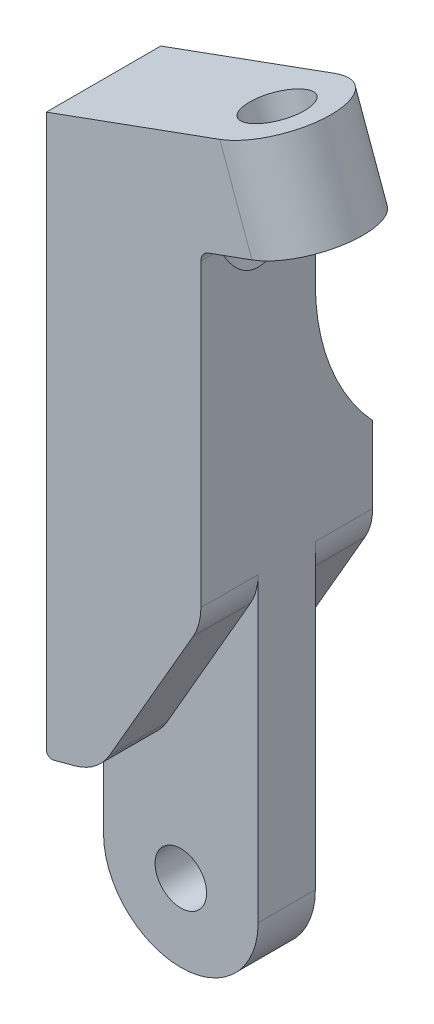
from build123d import *

# Parameters (mm, degrees)
BOSS_EXTRUDE1_DEPTH    = 7.5
CUT_EXTRUDE1_DEPTH     = 5
M4_CLEARANCE_HOLE1_D   = 4.5
BOSS_EXTRUDE2_DEPTH    = 15
CUT_EXTRUDE5_START     = -15
CUT_EXTRUDE5_DEPTH     = 5
FILLET8_R              = 1
FILLET4_R              = 19
FILLET1_R              = 0.5
FILLET7_R              = 5
FILLET6_RADIUS         = 5
FILLET6_LENGTH         = 8.210867904
F_10_CLEARANCE_HOLE1_D = 5.1054
FILLET9_R              = 5
FILLET10_R             = 1
SKETCH15_R             = 6
CUT_EXTRUDE7_DEPTH     = 16


with BuildPart() as part:
    # Sketch1 → Boss-Extrude1 (new, symmetric)
    with BuildSketch(Plane.XY):
        with BuildLine():
            Line((-6.749999988, 53.250000012), (6.749999988, 53.250000012))
            Line((6.749999988, 53.250000012), (6.749999988, 0))
            ThreePointArc((6.749999988, 0), (0, -6.749999988), (-6.749999988, 0))
            Line((-6.749999988, 0), (-6.749999988, 53.250000012))
        make_face()
    extrude(amount=BOSS_EXTRUDE1_DEPTH, both=True)

    # Sketch3 → Cut-Extrude1 (cut)
    with BuildSketch(Plane.XY.offset(7.5)):
        with BuildLine():
            Line((-6.749999988, 0), (-6.749999988, 8.205771407))
            Line((-6.749999988, 8.205771407), (-2.249999988, 9.411542773))
            Line((-2.249999988, 9.411542773), (6.749999988, 25))
            Line((6.749999988, 25), (6.749999988, 0))
            ThreePointArc((6.749999988, 0), (0, -6.749999988), (-6.749999988, 0))
        make_face()
    cut_extrude1 = extrude(amount=-CUT_EXTRUDE1_DEPTH, mode=Mode.SUBTRACT)

    # M4 Clearance Hole1 (through all)
    with Locations(Plane.XY.offset(2.5)):
        with Locations((0, 0)):
            Hole(M4_CLEARANCE_HOLE1_D / 2)

    # Mirror1: Cut-Extrude1 across plane
    add(cut_extrude1.mirror(Plane.XY), mode=Mode.SUBTRACT)

    # Sketch8 → Boss-Extrude2 (add)
    with BuildSketch(Plane.XY.offset(7.5)):
        Polygon((13.103097639, 64.300161569), (8.404634535, 62.590060852), (-6.749999988, 57.074224974), (-6.749999988, 53.250000012), (6.749999988, 53.250000012), (15.911379857, 56.584469589), align=None)
    extrude(amount=-BOSS_EXTRUDE2_DEPTH)

    # Sketch9 → Cut-Extrude5 (cut)
    with BuildSketch(Plane.XY.offset(7.5).offset(CUT_EXTRUDE5_START)):
        Polygon((-6.749999988, 16.617314139), (2.708548104, 33), (6.749999988, 33), (6.749999988, 53.250000012), (15.911379857, 56.584469589), (13.103097639, 64.300161569), (-6.749999988, 57.074224974), align=None)
    extrude(amount=CUT_EXTRUDE5_DEPTH, mode=Mode.SUBTRACT)

    # Fillet8
    fillet8_edges = [part.edges().sort_by_distance(p)[0] for p in [
        (2.708548104, 33, -5),
    ]]
    fillet(fillet8_edges, radius=FILLET8_R)

    # Fillet4
    # the kernel refuses this fillet: 19 mm, written as the material it adds along each edge
    with BuildSketch(Plane(origin=(3.285898373, 33, -2.5), x_dir=(0, 1, 0), z_dir=(1, 0, 0))) as fillet4_piece_1:
        with BuildLine():
            CenterArc((12.845232579, -19), FILLET4_R, 90, 42.536898363)
            Line((0, -5), (0, 0))
            Line((0, 0), (12.845232579, 0))
        make_face()
    extrude(amount=3.464101615)
    with BuildSketch(Plane(origin=(-22.806540711, -11.193430188, -2.5), x_dir=(-0.8660254037844388, 0.4999999999999999, 0), z_dir=(0.4999999999999999, 0.8660254037844388, 0))) as fillet4_piece_2_section:
        with BuildLine():
            CenterArc((12.845232579, -19), FILLET4_R, 90, 42.536898363)
            Line((0, -5), (0, 0))
            Line((0, 0), (12.845232579, 0))
        make_face()
    fillet4_piece_2 = extrude(amount=50.452827361, mode=Mode.PRIVATE)
    fillet4_piece_2 = split(fillet4_piece_2, bisect_by=Plane(origin=(-6.749999988, -11.193430188, -2.5), z_dir=(1, 0, 0)), keep=Keep.TOP, mode=Mode.PRIVATE)
    add(fillet4_piece_2)
    with BuildSketch(Plane(origin=(3.285898373, 32, -2.5), x_dir=(-0.8660254037844386, 0.4999999999999999, 0), z_dir=(-0.4999999999999999, -0.8660254037844386, 0))) as fillet4_piece_3_section:
        with BuildLine():
            CenterArc((13.845232579, 19), FILLET4_R, 227.463101637, 42.536898363)
            Line((1, 5), (1, 0))
            Line((1, 0), (13.845232579, 0))
        make_face()
    fillet4_piece_3 = revolve(axis=Axis((3.285898373, 32, -2.5), (0, 0, -1)), revolution_arc=60, mode=Mode.PRIVATE)
    fillet4_piece_3 = split(fillet4_piece_3, bisect_by=Plane(origin=(-6.749999988, 32, -2.5), z_dir=(1, 0, 0)), keep=Keep.TOP, mode=Mode.PRIVATE)
    add(fillet4_piece_3)

    # Fillet1
    fillet1_edges = [part.edges().sort_by_distance(p)[0] for p in [
        (-6.749999988, 8.205771407, 5),
        (-6.749999988, 8.205771407, -5),
    ]]
    fillet(fillet1_edges, radius=FILLET1_R)

    # Fillet7
    fillet7_edges = [part.edges().sort_by_distance(p)[0] for p in [
        (6.749999988, 25, 5),
        (6.749999988, 25, -5),
    ]]
    fillet(fillet7_edges, radius=FILLET7_R)

    # Fillet6: full round fillet: the end face becomes a half cylinder, R = half its width
    fillet6_face = Plane((14.507238748, 60.442315579, 2.5), x_dir=(0.342020143326, -0.939692620786, 0), z_dir=(0.939692620786, 0.342020143326, 0))  # on the end face: x along it, z out of the body
    fillet6_slab = fillet6_face.offset(-FILLET6_RADIUS / 2) * Box(FILLET6_LENGTH, 2 * FILLET6_RADIUS, FILLET6_RADIUS, mode=Mode.PRIVATE)  # the body's end, R deep
    fillet6_round = Plane((9.808775644, 58.732214862, 2.5), x_dir=(0.939692620786, 0.342020143326, 0), z_dir=(0.342020143326, -0.939692620786, 0)) * Cylinder(FILLET6_RADIUS, FILLET6_LENGTH, mode=Mode.PRIVATE)  # its axis R under the face
    add(fillet6_slab - fillet6_round, mode=Mode.SUBTRACT)

    # #10 Clearance Hole1 (through all)
    with Locations(Plane(origin=(-19.132902326, 52.56721711, 0), x_dir=(0.9396926207859103, 0.3420201433256639, 0), z_dir=(-0.3420201433256639, 0.9396926207859103, 0))):
        with Locations((29.304834637, -2.5)):
            Hole(F_10_CLEARANCE_HOLE1_D / 2)

    # Fillet9
    fillet9_edges = [part.edges().sort_by_distance(p)[0] for p in [
        (-2.249999988, 9.411542773, 5),
        (-2.249999988, 9.411542773, -5),
    ]]
    fillet(fillet9_edges, radius=FILLET9_R)

    # Fillet10
    fillet10_edges = [part.edges().sort_by_distance(p)[0] for p in [
        (6.749999988, 53.250000012, 2.5),
    ]]
    fillet(fillet10_edges, radius=FILLET10_R)

    # Sketch15 → Cut-Extrude7 (cut)
    with BuildSketch(Plane(origin=(-16.324620109, 44.85152513, 0), x_dir=(0.9396926207859103, 0.3420201433256634, 0), z_dir=(0.3420201433256634, -0.9396926207859103, 0))):
        with Locations((29.304834637, 2.5)):
            Circle(SKETCH15_R)
    extrude(amount=CUT_EXTRUDE7_DEPTH, mode=Mode.SUBTRACT)


solid = part.part
